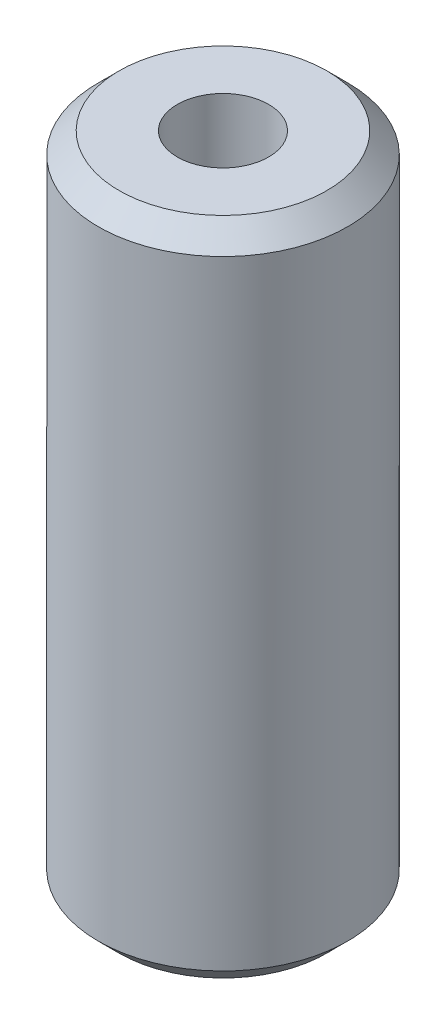
from build123d import *

# Parameters (mm, degrees)
SKETCH1_R           = 30
BOSS_EXTRUDE1_DEPTH = 158.910353638
SKETCH2_R           = 10.983427874
CUT_EXTRUDE1_DEPTH  = 165.476443582
CHAMFER1_SIZE       = 5.018055508


with BuildPart() as part:
    # Sketch1 → Boss-Extrude1 (new body)
    with BuildSketch(Plane(origin=(0, 0, 0), x_dir=(1, 0, 0), z_dir=(0, 1, 0))):
        Circle(SKETCH1_R)
    extrude(amount=BOSS_EXTRUDE1_DEPTH)

    # Sketch2 → Cut-Extrude1 (cut, through all)
    with BuildSketch(Plane(origin=(0, 0, 0), x_dir=(1, 0, 0), z_dir=(0, 1, 0))):
        Circle(SKETCH2_R)
    extrude(amount=CUT_EXTRUDE1_DEPTH, mode=Mode.SUBTRACT)

    # Chamfer1
    chamfer1_edges = [part.edges().sort_by_distance(p)[0] for p in [
        (-30, 158.910353638, 0),
        (-30, 0, 0),
    ]]
    chamfer(chamfer1_edges, length=CHAMFER1_SIZE)


solid = part.part
